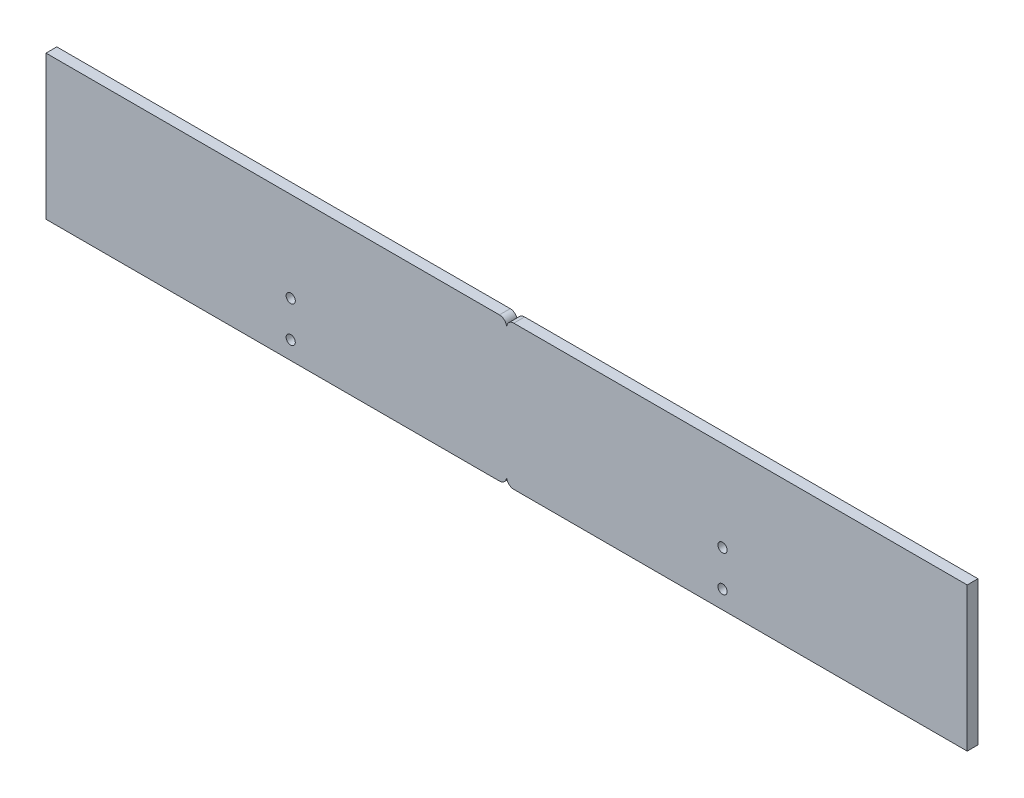
from build123d import *

# Parameters (mm, degrees)
SKETCH_1_W          = 512
SKETCH_1_H          = 80
EXTRUDE_1_DEPTH     = 6
SKETCH_2_R          = 2.55
CUT_EXTRUDE_1_DEPTH = 568.398840135


with BuildPart() as part:
    # Эскиз1 → Бобышка-Вытянуть1 (new body)
    with BuildSketch(Plane.XY):
        with Locations((256, -204.461538462)):
            Rectangle(SKETCH_1_W, SKETCH_1_H)
    extrude(amount=EXTRUDE_1_DEPTH)

    # Эскиз2 → Вырез-Вытянуть1 (cut, through all)
    with BuildSketch(Plane.XY.offset(6)):
        with Locations((376, -234.461538462)):
            Circle(SKETCH_2_R)
        with Locations((376, -214.461538462)):
            Circle(SKETCH_2_R)
        with Locations((136, -234.461538462)):
            Circle(SKETCH_2_R)
        with Locations((136, -214.461538462)):
            Circle(SKETCH_2_R)
        with BuildLine():
            Line((259.98727413, -244.461538462), (252.01272587, -244.461538462))
            ThreePointArc((252.01272587, -244.461538462), (254.832154446, -243.293692907), (256, -240.474264331))
            ThreePointArc((256, -240.474264331), (257.167845554, -243.293692907), (259.98727413, -244.461538462))
        make_face()
        with BuildLine():
            Line((259.98727413, -164.461538462), (252.01272587, -164.461538462))
            ThreePointArc((252.01272587, -164.461538462), (254.832154446, -165.629384016), (256, -168.448812592))
            ThreePointArc((256, -168.448812592), (257.167845554, -165.629384016), (259.98727413, -164.461538462))
        make_face()
    extrude(amount=-CUT_EXTRUDE_1_DEPTH, mode=Mode.SUBTRACT)


solid = part.part
